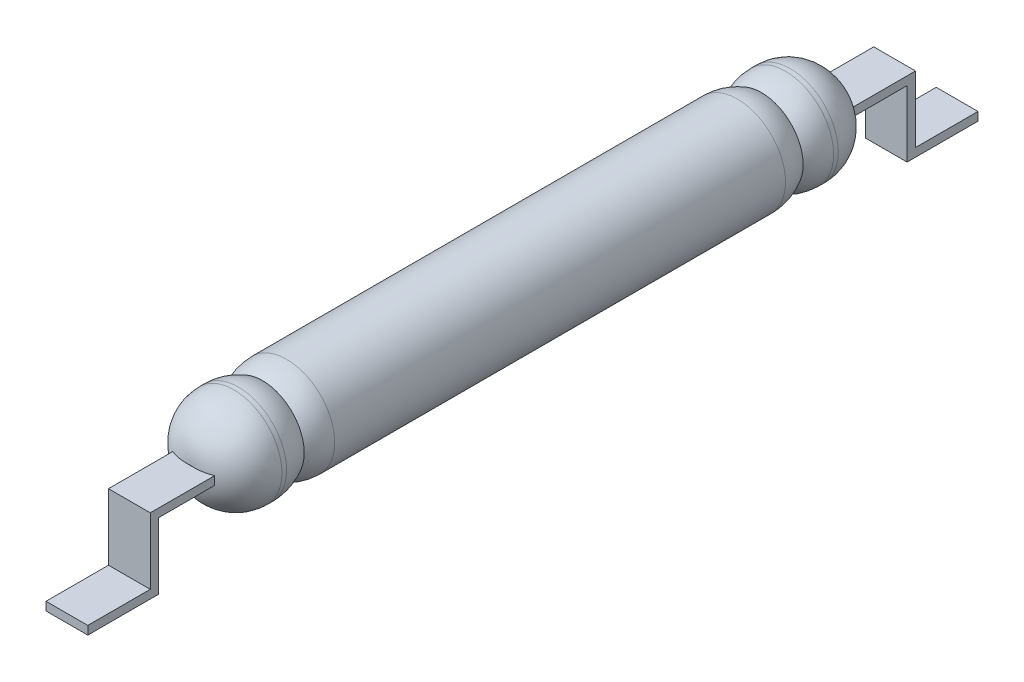
from build123d import *

# Parameters (mm, degrees)
SKETCH1_R        = 1.14
EXTRUSION1_DEPTH = 15.24
EXTRUSION2_DEPTH = 0.495
FILLET3_R        = 1.03


with BuildPart() as part:
    # Sketch1 → Extrusion1 (new body)
    with BuildSketch(Plane.XY):
        Circle(SKETCH1_R)
    extrude(amount=EXTRUSION1_DEPTH)

    # Sketch3 → Revolution3 (revolve, cut)
    with BuildSketch(Plane.YZ, mode=Mode.PRIVATE) as revolution3_sk:
        with BuildLine():
            Line((1.14, 12.96), (1.14, 14.1))
            ThreePointArc((1.14, 14.1), (1.101155442, 13.804946289), (0.98726896, 13.53))
            ThreePointArc((0.98726896, 13.53), (1.101155442, 13.255053711), (1.14, 12.96))
        make_face()
    revolution3 = revolve(revolution3_sk.sketch.rotate(Axis((0, 0, 14.1), (0, 0, -1)), 90), axis=Axis((0, 0, 14.1), (0, 0, -1)), mode=Mode.SUBTRACT)

    # Mirror2: Revolution3 across plane
    add(revolution3.mirror(Plane.XY.offset(7.62)), mode=Mode.SUBTRACT)

    # Sketch4 → Extrusion2 (add, symmetric)
    with BuildSketch(Plane.YZ):
        with BuildLine():
            Line((-0.1, 0), (0, 0))
            ThreePointArc((0, 0), (-0.050048254, 0.001099138), (-0.1, 0.004394435))
            Line((-0.1, 0.004394435), (-0.1, 0))
        make_face()
        with BuildLine():
            ThreePointArc((0, 0), (0.050048254, 0.001099138), (0.1, 0.004394435))
            Line((0.1, 0.004394435), (0.1, 0.138771336))
            Line((0.1, 0.138771336), (-0.1, 0.138771336))
            Line((-0.1, 0.138771336), (-0.1, 0.004394435))
            ThreePointArc((-0.1, 0.004394435), (-0.050048254, 0.001099138), (0, 0))
        make_face()
        Polygon((0.1, -1.445), (0.1, 0), (0, 0), (-0.1, 0), (-0.1, -1.245), (-1.67, -1.245), (-1.67, -2.925), (-1.47, -2.925), (-1.47, -1.445), align=None)
    extrusion2 = extrude(amount=EXTRUSION2_DEPTH, both=True)

    # Mirror3: Extrusion2 across plane
    add(extrusion2.mirror(Plane.XY.offset(7.62)))

    # Fillet3
    # the kernel refuses this fillet: 1.03 mm, written as the material it takes off along each edge
    with BuildSketch(Plane(origin=(0, 0, 15.24), x_dir=(1, 0, 0), z_dir=(0, -1, 0))) as fillet3_piece_1_section:
        with BuildLine():
            CenterArc((1.14 - FILLET3_R, -FILLET3_R), FILLET3_R, 0, 90)
            Line((1.14 - FILLET3_R, 0), (1.14, 0))
            Line((1.14, 0), (1.14, -FILLET3_R))
        make_face()
    fillet3_piece_1 = revolve(axis=Axis((0, 0, 15.24), (0, 0, 1)), mode=Mode.PRIVATE)
    fillet3_piece_1 = split(fillet3_piece_1, bisect_by=Plane(origin=(0.495, 4e-09, 15.000808078), z_dir=(1, 0, 0)), keep=Keep.TOP, mode=Mode.PRIVATE)
    add(fillet3_piece_1, mode=Mode.SUBTRACT)
    with BuildSketch(Plane(origin=(0, 0, 15.24), x_dir=(1, 0, 0), z_dir=(0, -1, 0))) as fillet3_piece_2_section:
        with BuildLine():
            CenterArc((1.14 - FILLET3_R, -FILLET3_R), FILLET3_R, 0, 90)
            Line((1.14 - FILLET3_R, 0), (1.14, 0))
            Line((1.14, 0), (1.14, -FILLET3_R))
        make_face()
    fillet3_piece_2 = revolve(axis=Axis((0, 0, 15.24), (0, 0, 1)), mode=Mode.PRIVATE)
    fillet3_piece_2 = split(fillet3_piece_2, bisect_by=Plane(origin=(0, 0.1, 15.013614208), z_dir=(0, 1, 0)), keep=Keep.TOP, mode=Mode.PRIVATE)
    add(fillet3_piece_2, mode=Mode.SUBTRACT)
    with BuildSketch(Plane(origin=(0, 0, 15.24), x_dir=(1, 0, 0), z_dir=(0, -1, 0))) as fillet3_piece_3_section:
        with BuildLine():
            CenterArc((1.14 - FILLET3_R, -FILLET3_R), FILLET3_R, 0, 90)
            Line((1.14 - FILLET3_R, 0), (1.14, 0))
            Line((1.14, 0), (1.14, -FILLET3_R))
        make_face()
    fillet3_piece_3 = revolve(axis=Axis((0, 0, 15.24), (0, 0, 1)), mode=Mode.PRIVATE)
    fillet3_piece_3 = split(fillet3_piece_3, bisect_by=Plane(origin=(8e-09, -0.1, 15.013614602), z_dir=(0, -1, 0)), keep=Keep.TOP, mode=Mode.PRIVATE)
    add(fillet3_piece_3, mode=Mode.SUBTRACT)
    with BuildSketch(Plane(origin=(0, 0, 15.24), x_dir=(1, 0, 0), z_dir=(0, -1, 0))) as fillet3_piece_4_section:
        with BuildLine():
            CenterArc((1.14 - FILLET3_R, -FILLET3_R), FILLET3_R, 0, 90)
            Line((1.14 - FILLET3_R, 0), (1.14, 0))
            Line((1.14, 0), (1.14, -FILLET3_R))
        make_face()
    fillet3_piece_4 = revolve(axis=Axis((0, 0, 15.24), (0, 0, 1)), mode=Mode.PRIVATE)
    fillet3_piece_4 = split(fillet3_piece_4, bisect_by=Plane(origin=(-0.495, -1e-09, 15.000807979), z_dir=(-1, 0, 0)), keep=Keep.TOP, mode=Mode.PRIVATE)
    add(fillet3_piece_4, mode=Mode.SUBTRACT)
    with BuildSketch(Plane(origin=(0, 0, 0), x_dir=(1, 0, 0), z_dir=(0, -1, 0))) as fillet3_piece_5_section:
        with BuildLine():
            CenterArc((1.14 - FILLET3_R, FILLET3_R), FILLET3_R, 270, 90)
            Line((1.14 - FILLET3_R, 0), (1.14, 0))
            Line((1.14, 0), (1.14, FILLET3_R))
        make_face()
    fillet3_piece_5 = revolve(axis=Axis((0, 0, 0), (0, 0, 1)), mode=Mode.PRIVATE)
    fillet3_piece_5 = split(fillet3_piece_5, bisect_by=Plane(origin=(0.495, 4e-09, 0.239191922), z_dir=(1, 0, 0)), keep=Keep.TOP, mode=Mode.PRIVATE)
    add(fillet3_piece_5, mode=Mode.SUBTRACT)
    with BuildSketch(Plane(origin=(0, 0, 0), x_dir=(1, 0, 0), z_dir=(0, -1, 0))) as fillet3_piece_6_section:
        with BuildLine():
            CenterArc((1.14 - FILLET3_R, FILLET3_R), FILLET3_R, 270, 90)
            Line((1.14 - FILLET3_R, 0), (1.14, 0))
            Line((1.14, 0), (1.14, FILLET3_R))
        make_face()
    fillet3_piece_6 = revolve(axis=Axis((0, 0, 0), (0, 0, 1)), mode=Mode.PRIVATE)
    fillet3_piece_6 = split(fillet3_piece_6, bisect_by=Plane(origin=(0, 0.1, 0.226385792), z_dir=(0, 1, 0)), keep=Keep.TOP, mode=Mode.PRIVATE)
    add(fillet3_piece_6, mode=Mode.SUBTRACT)
    with BuildSketch(Plane(origin=(0, 0, 0), x_dir=(1, 0, 0), z_dir=(0, -1, 0))) as fillet3_piece_7_section:
        with BuildLine():
            CenterArc((1.14 - FILLET3_R, FILLET3_R), FILLET3_R, 270, 90)
            Line((1.14 - FILLET3_R, 0), (1.14, 0))
            Line((1.14, 0), (1.14, FILLET3_R))
        make_face()
    fillet3_piece_7 = revolve(axis=Axis((0, 0, 0), (0, 0, 1)), mode=Mode.PRIVATE)
    fillet3_piece_7 = split(fillet3_piece_7, bisect_by=Plane(origin=(8e-09, -0.1, 0.226385398), z_dir=(0, -1, 0)), keep=Keep.TOP, mode=Mode.PRIVATE)
    add(fillet3_piece_7, mode=Mode.SUBTRACT)
    with BuildSketch(Plane(origin=(0, 0, 0), x_dir=(1, 0, 0), z_dir=(0, -1, 0))) as fillet3_piece_8_section:
        with BuildLine():
            CenterArc((1.14 - FILLET3_R, FILLET3_R), FILLET3_R, 270, 90)
            Line((1.14 - FILLET3_R, 0), (1.14, 0))
            Line((1.14, 0), (1.14, FILLET3_R))
        make_face()
    fillet3_piece_8 = revolve(axis=Axis((0, 0, 0), (0, 0, 1)), mode=Mode.PRIVATE)
    fillet3_piece_8 = split(fillet3_piece_8, bisect_by=Plane(origin=(-0.495, -1e-09, 0.239192021), z_dir=(-1, 0, 0)), keep=Keep.TOP, mode=Mode.PRIVATE)
    add(fillet3_piece_8, mode=Mode.SUBTRACT)


solid = part.part
